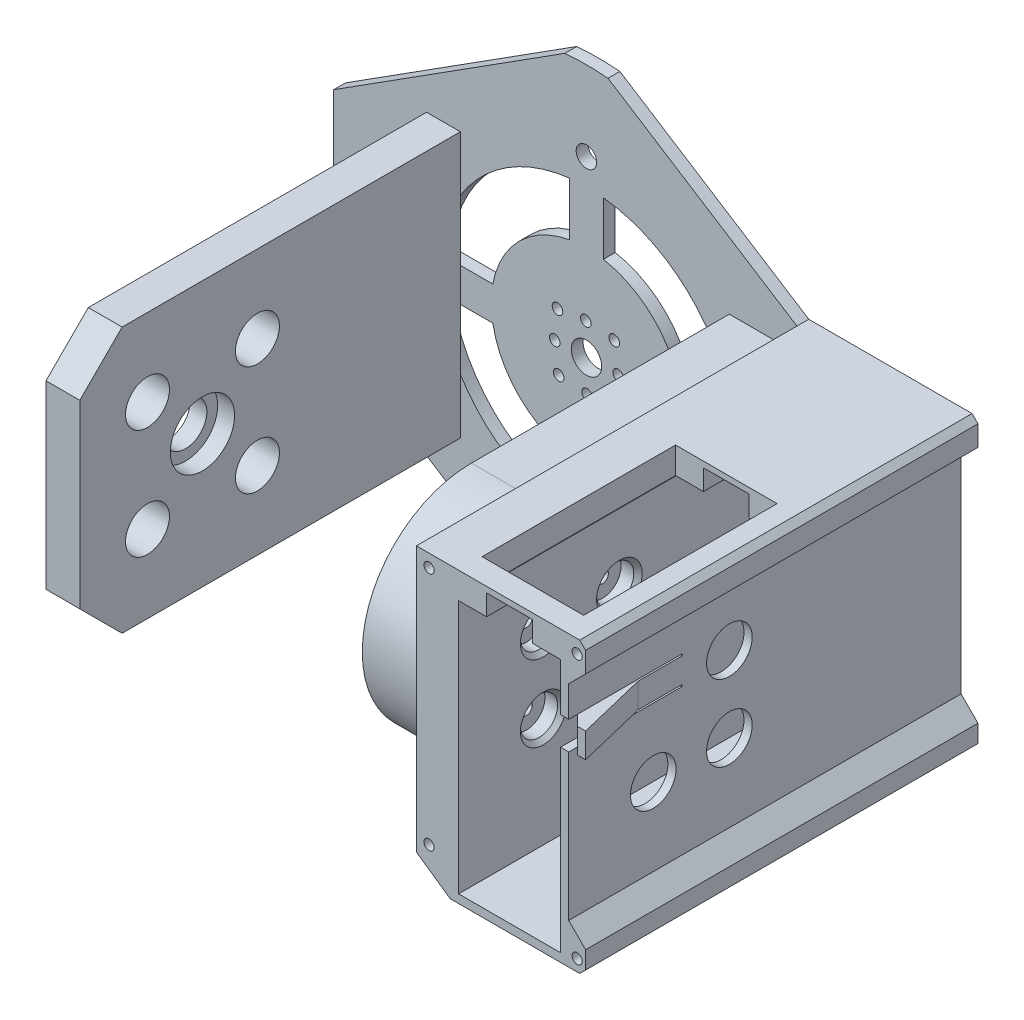
from build123d import *

# Parameters (mm, degrees)
SKETCH_1_R           = 47
SKETCH_1_R_2         = 1.25
SKETCH_1_R_3         = 3.6
SKETCH_1_R_4         = 2.425
EXTRUDE_1_DEPTH      = 3
EXTRUDE_START        = -2.8
SKETCH_2_R           = 2.425
SKETCH_2_R_2         = 47
EXTRUDE_3_DEPTH      = 2.8
SKETCH_3_R           = 2.425
EXTRUDE_4_DEPTH      = 80
CUT_EXTRUDE_1_DEPTH  = 10
EXTRUDE_5_DEPTH      = 16
SKETCH_6_W           = 10
SKETCH_6_H           = 50
EXTRUDE_6_DEPTH      = 10
CUT_EXTRUDE_START    = -16
CUT_EXTRUDE_2_DEPTH  = 16
EXTRUDE_START_2      = -16
EXTRUDE_7_DEPTH      = 16
CUT_EXTRUDE_3_REACH  = 125.588
SKETCH_11_W          = 8
SKETCH_11_H          = 62.723083634
EXTRUDE_8_DEPTH      = 90
SKETCH_12_R          = 5.05
CUT_EXTRUDE_4_DEPTH  = 8
SKETCH_13_W          = 5.4
SKETCH_13_H          = 5.6
SKETCH_13_R          = 1.4
SKETCH_13_W_2        = 1
EXTRUDE_9_DEPTH      = 9
CHAMFER_2_SIZE       = 10
CUT_EXTRUDE_START_2  = -4
SKETCH_14_R          = 4.4
SKETCH_14_R_2        = 1.4
CUT_EXTRUDE_5_DEPTH  = 4
SKETCH_15_R          = 2.425
CUT_EXTRUDE_6_DEPTH  = 2.8
CHAMFER_3_SIZE       = 1
EXTRUDE_10_DEPTH     = 10
SKETCH_17_R          = 47
SKETCH_17_R_2        = 1.25
SKETCH_17_R_3        = 2.425
SKETCH_17_R_4        = 3.6
CUT_EXTRUDE_7_DEPTH  = 0.2
EXTRUDE_START_3      = 82.8
SKETCH_19_R          = 2.425
EXTRUDE_11_DEPTH     = 82.8
SKETCH_20_R          = 2.425
EXTRUDE_12_DEPTH     = 2.8
EXTRUDE_13_DEPTH     = 92.8
SKETCH_22_W          = 92.8
SKETCH_22_H          = 6.241541817
EXTRUDE_14_DEPTH     = 2
EXTRUDE_15_REACH     = 141.907
EXTRUDE_16_DEPTH     = 92.8
SKETCH_25_W          = 92.8
SKETCH_25_H          = 60.05
EXTRUDE_17_DEPTH     = 1.94
CUT_EXTRUDE_8_REACH  = 158.07
SKETCH_26_W          = 24.02
SKETCH_26_H          = 45.757104247
SKETCH_27_W          = 4.81
SKETCH_27_H          = 5.88
EXTRUDE_19_DEPTH     = 3
CUT_EXTRUDE_9_DEPTH  = 1.94
CHAMFER_4_SIZE       = 1
SKETCH_29_W          = 1.94
SKETCH_29_H          = 0.4
CUT_EXTRUDE_10_DEPTH = 10
SKETCH_31_W          = 4
SKETCH_31_H          = 6.241541817
SKETCH_31_R          = 1.2
SKETCH_31_H_2        = 5.568458183
EXTRUDE_21_DEPTH     = 10
SKETCH_32_W          = 4
SKETCH_32_H          = 5.568458183
SKETCH_32_H_2        = 6.241541817
EXTRUDE_22_DEPTH     = 82.8
CHAMFER_5_SIZE       = 4
CHAMFER_6_SIZE       = 1.4
CUT_EXTRUDE_11_DEPTH = 10
EXTRUDE_23_DEPTH     = 5.88
CHAMFER_7_SIZE       = 4
SKETCH_35_R          = 7.6
SKETCH_35_R_2        = 7.5
SKETCH_35_R_3        = 5.05
CUT_EXTRUDE_12_DEPTH = 4
SKETCH_36_R          = 5.2
CUT_EXTRUDE_13_DEPTH = 8
SKETCH_37_R          = 5.4
CUT_EXTRUDE_14_DEPTH = 1.94


with BuildPart() as part:
    # 草图1 → 凸台-拉伸1 (new body)
    with BuildSketch(Plane.XY):
        Circle(SKETCH_1_R)
        with BuildLine():
            Line((34.770677301, 4), (22.141589825, 4))
            ThreePointArc((22.141589825, 4), (15.909902577, 15.909902577), (4, 22.141589825))
            Line((4, 22.141589825), (4, 34.770677301))
            ThreePointArc((4, 34.770677301), (24.748737342, 24.748737342), (34.770677301, 4))
        make_face(mode=Mode.SUBTRACT)
        with BuildLine():
            Line((-4, 34.770677301), (-4, 22.141589825))
            ThreePointArc((-4, 22.141589825), (-15.909902577, 15.909902577), (-22.141589825, 4))
            Line((-22.141589825, 4), (-34.770677301, 4))
            ThreePointArc((-34.770677301, 4), (-24.748737342, 24.748737342), (-4, 34.770677301))
        make_face(mode=Mode.SUBTRACT)
        with BuildLine():
            Line((-34.770677301, -4), (-22.141589825, -4))
            ThreePointArc((-22.141589825, -4), (-15.909902577, -15.909902577), (-4, -22.141589825))
            Line((-4, -22.141589825), (-4, -34.770677301))
            ThreePointArc((-4, -34.770677301), (-24.748737342, -24.748737342), (-34.770677301, -4))
        make_face(mode=Mode.SUBTRACT)
        with BuildLine():
            Line((4, -34.770677301), (4, -22.141589825))
            ThreePointArc((4, -22.141589825), (15.909902577, -15.909902577), (22.141589825, -4))
            Line((22.141589825, -4), (34.770677301, -4))
            ThreePointArc((34.770677301, -4), (24.748737342, -24.748737342), (4, -34.770677301))
        make_face(mode=Mode.SUBTRACT)
        with Locations((-7.498535673, -0.148198363)):
            Circle(SKETCH_1_R_2, mode=Mode.SUBTRACT)
        Circle(SKETCH_1_R_3, mode=Mode.SUBTRACT)
        with Locations((0.148198363, -7.498535673)):
            Circle(SKETCH_1_R_2, mode=Mode.SUBTRACT)
        with Locations((-0.148198363, 7.498535673)):
            Circle(SKETCH_1_R_2, mode=Mode.SUBTRACT)
        with Locations((7.498535673, 0.148198363)):
            Circle(SKETCH_1_R_2, mode=Mode.SUBTRACT)
        with Locations((6.583466251, 6.848939489)):
            Circle(SKETCH_1_R_2, mode=Mode.SUBTRACT)
        with Locations((6.848939489, -6.583466251)):
            Circle(SKETCH_1_R_2, mode=Mode.SUBTRACT)
        with Locations((-6.848939489, 6.583466251)):
            Circle(SKETCH_1_R_2, mode=Mode.SUBTRACT)
        with Locations((-6.583466251, -6.848939489)):
            Circle(SKETCH_1_R_2, mode=Mode.SUBTRACT)
        with Locations((0, -41.175)):
            Circle(SKETCH_1_R_4, mode=Mode.SUBTRACT)
        with Locations((-41.175, 0)):
            Circle(SKETCH_1_R_4, mode=Mode.SUBTRACT)
        with Locations((41.175, 0)):
            Circle(SKETCH_1_R_4, mode=Mode.SUBTRACT)
        with Locations((0, 41.175)):
            Circle(SKETCH_1_R_4, mode=Mode.SUBTRACT)
    extrude(amount=EXTRUDE_1_DEPTH)

    # 草图2 → 凸台-拉伸3 (add)
    # profile 1 of 5: a face of its own
    with BuildSketch(Plane.XY.offset(3).offset(EXTRUDE_START)):
        with BuildLine():
            Line((59.782310964, 25), (51.984099161, 29.960865048))
            ThreePointArc((51.984099161, 29.960865048), (57.248307808, 17.961939013), (59.782310964, 5.106397535))
            Line((59.782310964, 5.106397535), (59.782310964, 25))
        make_face()
    # profile 2 of 5: a face of its own
    with BuildSketch(Plane.XY.offset(3).offset(EXTRUDE_START)):
        with BuildLine():
            Line((59.782310964, -25), (59.782310964, -5.106397535))
            ThreePointArc((59.782310964, -5.106397535), (57.248307808, -17.961939013), (51.984099161, -29.960865048))
            Line((51.984099161, -29.960865048), (59.782310964, -25))
        make_face()
    # profile 3 of 5: a face of its own
    with BuildSketch(Plane.XY.offset(3).offset(EXTRUDE_START)):
        with BuildLine():
            ThreePointArc((5.106397535, 59.782310964), (0, 60), (-5.106397535, 59.782310964))
            Line((-5.106397535, 59.782310964), (-51.984099161, 29.960865048))
            ThreePointArc((-51.984099161, 29.960865048), (-57.248307808, 17.961939013), (-59.782310964, 5.106397535))
            Line((-59.782310964, 5.106397535), (-59.782310964, -5.106397535))
            ThreePointArc((-59.782310964, -5.106397535), (-57.248307808, -17.961939013), (-51.984099161, -29.960865048))
            Line((-51.984099161, -29.960865048), (-5.106397535, -59.782310964))
            ThreePointArc((-5.106397535, -59.782310964), (0, -60), (5.106397535, -59.782310964))
            Line((5.106397535, -59.782310964), (51.984099161, -29.960865048))
            ThreePointArc((51.984099161, -29.960865048), (57.248307808, -17.961939013), (59.782310964, -5.106397535))
            Line((59.782310964, -5.106397535), (59.782310964, 5.106397535))
            ThreePointArc((59.782310964, 5.106397535), (57.248307808, 17.961939013), (51.984099161, 29.960865048))
            Line((51.984099161, 29.960865048), (5.106397535, 59.782310964))
        make_face()
        with Locations((53.575, 0)):
            Circle(SKETCH_2_R, mode=Mode.SUBTRACT)
        with Locations((-53.575, 0)):
            Circle(SKETCH_2_R, mode=Mode.SUBTRACT)
        Circle(SKETCH_2_R_2, mode=Mode.SUBTRACT)
    # profile 4 of 5: a face of its own
    with BuildSketch(Plane.XY.offset(3).offset(EXTRUDE_START)):
        with BuildLine():
            ThreePointArc((-59.782310964, 5.106397535), (-57.248307808, 17.961939013), (-51.984099161, 29.960865048))
            Line((-51.984099161, 29.960865048), (-59.782310964, 25))
            Line((-59.782310964, 25), (-59.782310964, 5.106397535))
        make_face()
    # profile 5 of 5: a face of its own
    with BuildSketch(Plane.XY.offset(3).offset(EXTRUDE_START)):
        with BuildLine():
            ThreePointArc((-51.984099161, -29.960865048), (-57.248307808, -17.961939013), (-59.782310964, -5.106397535))
            Line((-59.782310964, -5.106397535), (-59.782310964, -25))
            Line((-59.782310964, -25), (-51.984099161, -29.960865048))
        make_face()
    extrude(amount=EXTRUDE_3_DEPTH)

    # 草图3 → 凸台-拉伸4 (add)
    # profile 1 of 2: a face of its own
    with BuildSketch(Plane.XY.offset(3)):
        Polygon((59.782310964, 25), (49.782310964, 25), (49.782310964, -31.361541817), (59.782310964, -25), align=None)
        with Locations((53.575, 0)):
            Circle(SKETCH_3_R, mode=Mode.SUBTRACT)
    # profile 2 of 2: a face of its own
    with BuildSketch(Plane.XY.offset(3)):
        Polygon((59.782310964, 25), (49.782310964, 31.361541817), (49.782310964, 25), align=None)
    extrude(amount=EXTRUDE_4_DEPTH)

    # 草图4 → 切除-拉伸1 (cut)
    with BuildSketch(Plane.ZY.offset(-49.782310964)):
        with BuildLine():
            ThreePointArc((71.6, 9), (72.010050506, 8.010050506), (73, 7.6))
            Line((73, 7.6), (73, 9))
            Line((73, 9), (71.6, 9))
        make_face()
        with BuildLine():
            Line((73, 9), (73, 7.6))
            ThreePointArc((73, 7.6), (73.989949494, 8.010050506), (74.4, 9))
            ThreePointArc((74.4, 9), (73, 10.4), (71.6, 9))
            Line((71.6, 9), (73, 9))
        make_face()
        with BuildLine():
            ThreePointArc((56.4, 9), (54.010050506, 9.989949494), (55, 7.6))
            Line((55, 7.6), (55, 9))
            Line((55, 9), (56.4, 9))
        make_face()
        with BuildLine():
            Line((55, 9), (55, 7.6))
            ThreePointArc((55, 7.6), (55.989949494, 8.010050506), (56.4, 9))
            Line((56.4, 9), (55, 9))
        make_face()
        with BuildLine():
            ThreePointArc((56.4, -9), (55.989949494, -8.010050506), (55, -7.6))
            Line((55, -7.6), (55, -9))
            Line((55, -9), (56.4, -9))
        make_face()
        with BuildLine():
            Line((55, -9), (55, -7.6))
            ThreePointArc((55, -7.6), (54.010050506, -9.989949494), (56.4, -9))
            Line((56.4, -9), (55, -9))
        make_face()
        with BuildLine():
            ThreePointArc((74.4, -9), (73.989949494, -8.010050506), (73, -7.6))
            Line((73, -7.6), (73, -9))
            Line((73, -9), (71.6, -9))
            ThreePointArc((71.6, -9), (73, -10.4), (74.4, -9))
        make_face()
        with BuildLine():
            Line((73, -9), (73, -7.6))
            ThreePointArc((73, -7.6), (72.010050506, -8.010050506), (71.6, -9))
            Line((71.6, -9), (73, -9))
        make_face()
    extrude(amount=-CUT_EXTRUDE_1_DEPTH, mode=Mode.SUBTRACT)

    # 草图5 → 凸台-拉伸5 (add)
    with BuildSketch(Plane.ZY.offset(-49.782310964)):
        with BuildLine():
            ThreePointArc((89.8, 0), (88.039966722, 9.365895579), (83, 17.453939383))
            Line((83, 17.453939383), (83, 12.603174203))
            ThreePointArc((83, 12.603174203), (85.829338057, 6.581793069), (86.8, 0))
            ThreePointArc((86.8, 0), (85.829338057, -6.581793069), (83, -12.603174203))
            Line((83, -12.603174203), (83, -17.453939383))
            ThreePointArc((83, -17.453939383), (88.039966722, -9.365895579), (89.8, 0))
        make_face()
        with BuildLine():
            Line((83, 12.603174203), (83, 17.453939383))
            ThreePointArc((83, 17.453939383), (38.2, 0), (83, -17.453939383))
            Line((83, -17.453939383), (83, -12.603174203))
            ThreePointArc((83, -12.603174203), (41.2, 0), (83, 12.603174203))
        make_face()
    extrude(amount=EXTRUDE_5_DEPTH)

    # 草图6 → 凸台-拉伸6 (add)
    with BuildSketch(Plane(origin=(59.782310964, 0, 0), x_dir=(0, 0, -1), z_dir=(1, 0, 0))):
        with Locations((-88, 0)):
            Rectangle(SKETCH_6_W, SKETCH_6_H)
    extrude(amount=-EXTRUDE_6_DEPTH)

    # 草图7 → 切除-拉伸2 (cut)
    with BuildSketch(Plane.ZY.offset(-33.782310964).offset(CUT_EXTRUDE_START)):
        with BuildLine():
            Line((42.003636664, 6), (38.9073716, 6))
            ThreePointArc((38.9073716, 6), (38.2, 0), (38.9073716, -6))
            Line((38.9073716, -6), (42.003636664, -6))
            ThreePointArc((42.003636664, -6), (41.2, 0), (42.003636664, 6))
        make_face()
    extrude(amount=CUT_EXTRUDE_2_DEPTH, mode=Mode.SUBTRACT)

    # 草图8 → 凸台-拉伸7 (add)
    with BuildSketch(Plane.ZY.offset(-33.782310964).offset(EXTRUDE_START_2)):
        with BuildLine():
            ThreePointArc((38.9073716, 6), (48.018135278, 20.253888516), (64, 25.8))
            Line((64, 25.8), (3, 25.8))
            Line((3, 25.8), (3, 6))
            Line((3, 6), (38.9073716, 6))
        make_face()
        with BuildLine():
            Line((3, -25.8), (64, -25.8))
            ThreePointArc((64, -25.8), (48.018135278, -20.253888516), (38.9073716, -6))
            Line((38.9073716, -6), (3, -6))
            Line((3, -6), (3, -25.8))
        make_face()
    extrude(amount=EXTRUDE_7_DEPTH)

    # 草图9 → 切除-拉伸3 (cut, up to next)
    with BuildSketch(Plane(origin=(0, 0, 3), x_dir=(-1, 0, 0), z_dir=(0, 0, -1)), mode=Mode.PRIVATE) as cut_extrude_3_sk1:
        with BuildLine():
            Line((-33.782310964, -6), (-34.481879299, -6))
            ThreePointArc((-34.481879299, -6), (-34.168455933, -7.5839712), (-33.782310964, -9.151801239))
            Line((-33.782310964, -9.151801239), (-33.782310964, -6))
        make_face()
    cut_extrude_3_tool1 = extrude(cut_extrude_3_sk1.sketch, amount=-CUT_EXTRUDE_3_REACH, mode=Mode.PRIVATE) & part.part
    # 草图9 → 切除-拉伸3 (cut, up to next)
    with BuildSketch(Plane(origin=(0, 0, 3), x_dir=(-1, 0, 0), z_dir=(0, 0, -1)), mode=Mode.PRIVATE) as cut_extrude_3_sk2:
        with BuildLine():
            Line((-33.782310964, 6), (-33.782310964, 9.151801239))
            ThreePointArc((-33.782310964, 9.151801239), (-34.168455933, 7.5839712), (-34.481879299, 6))
            Line((-34.481879299, 6), (-33.782310964, 6))
        make_face()
    cut_extrude_3_tool2 = extrude(cut_extrude_3_sk2.sketch, amount=-CUT_EXTRUDE_3_REACH, mode=Mode.PRIVATE) & part.part
    add(cut_extrude_3_tool1.solids().sort_by_distance((34.024391, -7.086431, 3))[0], mode=Mode.SUBTRACT)
    add(cut_extrude_3_tool2.solids().sort_by_distance((34.024391, 7.086431, 3))[0], mode=Mode.SUBTRACT)

    # 草图11 → 凸台-拉伸8 (add)
    with BuildSketch(Plane.XY.offset(3)):
        with Locations((-33.817689036, 0)):
            Rectangle(SKETCH_11_W, SKETCH_11_H)
    extrude(amount=EXTRUDE_8_DEPTH)

    # 草图12 → 切除-拉伸4 (cut)
    with BuildSketch(Plane.ZY.offset(37.817689036)):
        with Locations(Location((64, 0, 0), (0, 0, 270))):
            Circle(SKETCH_12_R)
    extrude(amount=-CUT_EXTRUDE_4_DEPTH, mode=Mode.SUBTRACT)

    # 草图13 → 凸台-拉伸9 (add)
    # profile 1 of 6: a face of its own
    with BuildSketch(Plane.ZY.offset(37.817689036)):
        with Locations((6.7, 14.838458183)):
            Rectangle(SKETCH_13_W, SKETCH_13_H)
        with Locations(Location((6.7, 14.838458183, 0), (0, 0, 270))):
            Circle(SKETCH_13_R, mode=Mode.SUBTRACT)
    # profile 2 of 6: a face of its own
    with BuildSketch(Plane.ZY.offset(37.817689036)):
        with Locations((3.5, 14.838458183)):
            Rectangle(SKETCH_13_W_2, SKETCH_13_H)
    # profile 3 of 6: a face of its own
    with BuildSketch(Plane.ZY.offset(37.817689036)):
        with Locations((6.7, -15.561541817)):
            Rectangle(SKETCH_13_W, SKETCH_13_H)
        with Locations(Location((6.7, -15.561541817, 0), (0, 0, 270))):
            Circle(SKETCH_13_R, mode=Mode.SUBTRACT)
    # profile 4 of 6: a face of its own
    with BuildSketch(Plane.ZY.offset(37.817689036)):
        with Locations((3.5, -15.561541817)):
            Rectangle(SKETCH_13_W_2, SKETCH_13_H)
    # profile 5 of 6: a face of its own
    with BuildSketch(Plane.ZY.offset(37.817689036)):
        with Locations((37.1, -15.561541817)):
            Rectangle(SKETCH_13_W, SKETCH_13_H)
        with Locations(Location((37.1, -15.561541817, 0), (0, 0, 270))):
            Circle(SKETCH_13_R, mode=Mode.SUBTRACT)
    # profile 6 of 6: a face of its own
    with BuildSketch(Plane.ZY.offset(37.817689036)):
        with Locations((37.1, 14.838458183)):
            Rectangle(SKETCH_13_W, SKETCH_13_H)
        with Locations(Location((37.1, 14.838458183, 0), (0, 0, 270))):
            Circle(SKETCH_13_R, mode=Mode.SUBTRACT)
    extrude(amount=EXTRUDE_9_DEPTH)

    # 倒角2
    chamfer_2_edges = [part.edges().sort_by_distance(p)[0] for p in [
        (-33.817689036, -31.361541817, 93),
        (-33.817689036, 31.361541817, 93),
    ]]
    chamfer(chamfer_2_edges, length=CHAMFER_2_SIZE)

    # 草图14 → 切除-拉伸5 (cut)
    # profile 1 of 4: a face of its own
    with BuildSketch(Plane(origin=(59.782310964, 0, 0), x_dir=(0, 0, -1), z_dir=(1, 0, 0)).offset(CUT_EXTRUDE_START_2)):
        with Locations((-73, 9)):
            Circle(SKETCH_14_R)
        with Locations(Location((-73, 9, 0), (0, 0, 270))):
            Circle(SKETCH_14_R_2, mode=Mode.SUBTRACT)
    # profile 2 of 4: a face of its own
    with BuildSketch(Plane(origin=(59.782310964, 0, 0), x_dir=(0, 0, -1), z_dir=(1, 0, 0)).offset(CUT_EXTRUDE_START_2)):
        with Locations((-73, -9)):
            Circle(SKETCH_14_R)
        with Locations(Location((-73, -9, 0), (0, 0, 270))):
            Circle(SKETCH_14_R_2, mode=Mode.SUBTRACT)
    # profile 3 of 4: a face of its own
    with BuildSketch(Plane(origin=(59.782310964, 0, 0), x_dir=(0, 0, -1), z_dir=(1, 0, 0)).offset(CUT_EXTRUDE_START_2)):
        with Locations((-55, -9)):
            Circle(SKETCH_14_R)
        with Locations(Location((-55, -9, 0), (0, 0, 270))):
            Circle(SKETCH_14_R_2, mode=Mode.SUBTRACT)
    # profile 4 of 4: a face of its own
    with BuildSketch(Plane(origin=(59.782310964, 0, 0), x_dir=(0, 0, -1), z_dir=(1, 0, 0)).offset(CUT_EXTRUDE_START_2)):
        with Locations((-55, 9)):
            Circle(SKETCH_14_R)
        with Locations(Location((-55, 9, 0), (0, 0, 270))):
            Circle(SKETCH_14_R_2, mode=Mode.SUBTRACT)
    extrude(amount=CUT_EXTRUDE_5_DEPTH, mode=Mode.SUBTRACT)

    # 草图15 → 切除-拉伸6 (cut)
    with BuildSketch(Plane.XY.offset(3)):
        with Locations((0.001, 53.576)):
            Circle(SKETCH_15_R)
        with Locations((0.001, -53.576)):
            Circle(SKETCH_15_R)
    extrude(amount=-CUT_EXTRUDE_6_DEPTH, mode=Mode.SUBTRACT)

    # 倒角3
    chamfer_3_edges = [part.edges().sort_by_distance(p)[0] for p in [
        (59.782310964, 9, 59.4),
        (59.782310964, -9, 59.4),
        (59.782310964, -9, 77.4),
        (59.782310964, 9, 77.4),
    ]]
    chamfer(chamfer_3_edges, length=CHAMFER_3_SIZE)

    # 草图16 → 凸台-拉伸10 (add)
    with BuildSketch(Plane.XY.offset(83)):
        Polygon((49.782310964, 25), (59.782310964, 25), (49.782310964, 31.361541817), align=None)
        Polygon((49.782310964, -31.361541817), (59.782310964, -25), (49.782310964, -25), align=None)
    extrude(amount=EXTRUDE_10_DEPTH)

    # 草图17 → 切除-拉伸7 (cut)
    with BuildSketch(Plane(origin=(0, 0, 0), x_dir=(-1, 0, 0), z_dir=(0, 0, -1))):
        Circle(SKETCH_17_R)
        with Locations(Location((7.498535673, -0.148198363, 0), (0, 0, 180))):
            Circle(SKETCH_17_R_2, mode=Mode.SUBTRACT)
        with Locations(Location((-7.498535673, 0.148198363, 0), (0, 0, 180))):
            Circle(SKETCH_17_R_2, mode=Mode.SUBTRACT)
        with Locations(Location((0.148198363, 7.498535673, 0), (0, 0, 180))):
            Circle(SKETCH_17_R_2, mode=Mode.SUBTRACT)
        with Locations(Location((0, -41.175, 0), (0, 0, 180))):
            Circle(SKETCH_17_R_3, mode=Mode.SUBTRACT)
        with Locations(Location((0, 41.175, 0), (0, 0, 180))):
            Circle(SKETCH_17_R_3, mode=Mode.SUBTRACT)
        with Locations(Location((6.583466251, -6.848939489, 0), (0, 0, 180))):
            Circle(SKETCH_17_R_2, mode=Mode.SUBTRACT)
        with Locations(Location((-6.848939489, -6.583466251, 0), (0, 0, 180))):
            Circle(SKETCH_17_R_2, mode=Mode.SUBTRACT)
        with Locations(Location((-41.175, 0, 0), (0, 0, 180))):
            Circle(SKETCH_17_R_3, mode=Mode.SUBTRACT)
        with Locations(Location((41.175, 0, 0), (0, 0, 180))):
            Circle(SKETCH_17_R_3, mode=Mode.SUBTRACT)
        with Locations(Location((6.848939489, 6.583466251, 0), (0, 0, 180))):
            Circle(SKETCH_17_R_2, mode=Mode.SUBTRACT)
        with Locations(Location((-6.583466251, 6.848939489, 0), (0, 0, 180))):
            Circle(SKETCH_17_R_2, mode=Mode.SUBTRACT)
        with Locations(Location((0, 0, 0), (0, 0, 180))):
            Circle(SKETCH_17_R_4, mode=Mode.SUBTRACT)
        with Locations(Location((-0.148198363, -7.498535673, 0), (0, 0, 180))):
            Circle(SKETCH_17_R_2, mode=Mode.SUBTRACT)
        with BuildLine():
            ThreePointArc((-22.141589825, -4), (-15.909902577, -15.909902577), (-4, -22.141589825))
            Line((-4, -22.141589825), (-4, -34.770677301))
            ThreePointArc((-4, -34.770677301), (-24.748737342, -24.748737342), (-34.770677301, -4))
            Line((-34.770677301, -4), (-22.141589825, -4))
        make_face(mode=Mode.SUBTRACT)
        with BuildLine():
            ThreePointArc((4, -22.141589825), (15.909902577, -15.909902577), (22.141589825, -4))
            Line((22.141589825, -4), (34.770677301, -4))
            ThreePointArc((34.770677301, -4), (24.748737342, -24.748737342), (4, -34.770677301))
            Line((4, -34.770677301), (4, -22.141589825))
        make_face(mode=Mode.SUBTRACT)
        with BuildLine():
            Line((-22.141589825, 4), (-34.770677301, 4))
            ThreePointArc((-34.770677301, 4), (-24.748737342, 24.748737342), (-4, 34.770677301))
            Line((-4, 34.770677301), (-4, 22.141589825))
            ThreePointArc((-4, 22.141589825), (-15.909902577, 15.909902577), (-22.141589825, 4))
        make_face(mode=Mode.SUBTRACT)
        with BuildLine():
            Line((34.770677301, 4), (22.141589825, 4))
            ThreePointArc((22.141589825, 4), (15.909902577, 15.909902577), (4, 22.141589825))
            Line((4, 22.141589825), (4, 34.770677301))
            ThreePointArc((4, 34.770677301), (24.748737342, 24.748737342), (34.770677301, 4))
        make_face(mode=Mode.SUBTRACT)
    extrude(amount=-CUT_EXTRUDE_7_DEPTH, mode=Mode.SUBTRACT)

    # 草图19 → 凸台-拉伸11 (add)
    with BuildSketch(Plane(origin=(0, 0, 83), x_dir=(-1, 0, 0), z_dir=(0, 0, -1)).offset(EXTRUDE_START_3)):
        with Locations((-53.575, 0)):
            Circle(SKETCH_19_R)
    extrude(amount=-EXTRUDE_11_DEPTH)

    # 草图20 → 凸台-拉伸12 (add)
    with BuildSketch(Plane(origin=(0, 0, 0.2), x_dir=(-1, 0, 0), z_dir=(0, 0, -1)).offset(EXTRUDE_START)):
        with Locations((53.575, 0)):
            Circle(SKETCH_20_R)
        with Locations((-0.001, 53.576)):
            Circle(SKETCH_20_R)
        with Locations((-0.001, -53.576)):
            Circle(SKETCH_20_R)
    extrude(amount=EXTRUDE_12_DEPTH)

    # 草图21 → 凸台-拉伸13 (add)
    with BuildSketch(Plane.XY.offset(93)):
        Polygon((66.372310964, 25.12), (66.372310964, 30), (77.212310964, 30), (77.212310964, 25.12), (83.802310964, 25.12), (83.802310964, 31.361541817), (49.782310964, 31.361541817), (59.662310964, 25.076338502), (59.662310964, 25.12), align=None)
    extrude(amount=-EXTRUDE_13_DEPTH)

    # 草图22 → 凸台-拉伸14 (add)
    with BuildSketch(Plane(origin=(83.802310964, 0, 0), x_dir=(0, 0, -1), z_dir=(1, 0, 0))):
        with Locations((-46.6, 28.240770909)):
            Rectangle(SKETCH_22_W, SKETCH_22_H)
    extrude(amount=EXTRUDE_14_DEPTH)

    # 凸台-拉伸15: up to this face of the body (flat: up to its plane)
    extrude_15_end = Plane(part.part.faces().sort_by_distance((60.734975473, 26.630023141, 0.2))[0])
    # 草图23 → 凸台-拉伸15 (add, up to the picked face)
    with BuildSketch(Plane.XY.offset(93), mode=Mode.PRIVATE) as extrude_15_sk1:
        Polygon((49.782310964, -31.361541817), (57.782310964, -36.93), (57.782310964, -34.93), (57.782310964, -26.272308363), align=None)
    extrude_15_tool1 = split(extrude(extrude_15_sk1.sketch, amount=-EXTRUDE_15_REACH, mode=Mode.PRIVATE), bisect_by=extrude_15_end, keep=Keep.BOTH, mode=Mode.PRIVATE)
    # 草图23 → 凸台-拉伸15 (add, up to the picked face)
    with BuildSketch(Plane.XY.offset(93), mode=Mode.PRIVATE) as extrude_15_sk2:
        Polygon((57.782310964, -34.93), (57.782310964, -36.93), (85.802310964, -36.93), (85.802310964, -34.93), (83.802310964, -34.93), (59.782310964, -34.93), align=None)
    extrude_15_tool2 = split(extrude(extrude_15_sk2.sketch, amount=-EXTRUDE_15_REACH, mode=Mode.PRIVATE), bisect_by=extrude_15_end, keep=Keep.BOTH, mode=Mode.PRIVATE)
    add(extrude_15_tool1.solids().sort_by(Axis((55.115644, -31.521283, 93), (0, 0, -1)))[0])
    add(extrude_15_tool2.solids().sort_by(Axis((71.792311, -35.93, 93), (0, 0, -1)))[0])

    # 草图24 → 凸台-拉伸16 (add)
    with BuildSketch(Plane.XY.offset(93)):
        Polygon((57.782310964, -34.93), (59.782310964, -34.93), (59.782310964, -25), (57.782310964, -26.272308363), align=None)
    extrude(amount=-EXTRUDE_16_DEPTH)

    # 草图25 → 凸台-拉伸17 (add)
    with BuildSketch(Plane(origin=(85.802310964, 0, 0), x_dir=(0, 0, -1), z_dir=(1, 0, 0))):
        with Locations((-46.6, -4.905)):
            Rectangle(SKETCH_25_W, SKETCH_25_H)
    extrude(amount=-EXTRUDE_17_DEPTH)

    # 切除-拉伸8: up to this face of the body (flat: up to its plane)
    cut_extrude_8_end = Plane(part.part.faces().sort_by_distance((63.017310964, 25.12, 46.6))[0])
    # 草图26 → 切除-拉伸8 (cut, up to the picked face)
    with BuildSketch(Plane(origin=(0, 31.361541817, 0), x_dir=(1, 0, 0), z_dir=(0, 1, 0)), mode=Mode.PRIVATE) as cut_extrude_8_sk1:
        with Locations((71.792310964, -64.588552124)):
            Rectangle(SKETCH_26_W, SKETCH_26_H)
    cut_extrude_8_tool1 = split(extrude(cut_extrude_8_sk1.sketch, amount=-CUT_EXTRUDE_8_REACH, mode=Mode.PRIVATE), bisect_by=cut_extrude_8_end, keep=Keep.BOTH, mode=Mode.PRIVATE)
    add(cut_extrude_8_tool1.solids().sort_by(Axis((71.792311, 31.361542, 64.588552), (0, -1, 0)))[0], mode=Mode.SUBTRACT)

    # 草图27 → 凸台-拉伸19 (add)
    with BuildSketch(Plane(origin=(85.802310964, 0, 0), x_dir=(0, 0, -1), z_dir=(1, 0, 0))):
        with Locations((-79.015, 10.49)):
            Rectangle(SKETCH_27_W, SKETCH_27_H)
    extrude(amount=-EXTRUDE_19_DEPTH)

    # 草图28 → 切除-拉伸9 (cut)
    with BuildSketch(Plane(origin=(85.802310964, 0, 0), x_dir=(0, 0, -1), z_dir=(1, 0, 0))):
        Polygon((-93, 7.15), (-81.42, 7.15), (-76.21, 7.15), (-76.21, 7.55), (-76.61, 7.55), (-81.42, 7.55), (-93, 7.55), align=None)
        Polygon((-76.61, 13.43), (-76.21, 13.43), (-76.21, 13.83), (-81.42, 13.83), (-93, 13.83), (-93, 13.43), (-81.42, 13.43), align=None)
    extrude(amount=-CUT_EXTRUDE_9_DEPTH, mode=Mode.SUBTRACT)

    # 倒角4
    chamfer_4_edges = [part.edges().sort_by_distance(p)[0] for p in [
        (82.802310964, 10.49, 76.61),
    ]]
    chamfer(chamfer_4_edges, length=CHAMFER_4_SIZE)

    # 草图29 → 切除-拉伸10 (cut)
    with BuildSketch(Plane.XY.offset(76.21)):
        with Locations((84.832310964, 13.63)):
            Rectangle(SKETCH_29_W, SKETCH_29_H)
        with Locations((84.832310964, 7.35)):
            Rectangle(SKETCH_29_W, SKETCH_29_H)
    extrude(amount=-CUT_EXTRUDE_10_DEPTH, mode=Mode.SUBTRACT)

    # 草图31 → 凸台-拉伸21 (add)
    # profile 1 of 2: a face of its own
    with BuildSketch(Plane.XY.offset(93)):
        with Locations((87.802310964, 28.240770909)):
            Rectangle(SKETCH_31_W, SKETCH_31_H)
        with Locations((87.802310964, 28.240770908)):
            Circle(SKETCH_31_R, mode=Mode.SUBTRACT)
    # profile 2 of 2: a face of its own
    with BuildSketch(Plane.XY.offset(93)):
        with Locations((87.802310964, -34.145770908)):
            Rectangle(SKETCH_31_W, SKETCH_31_H_2)
        with Locations((87.802310964, -34.145770908)):
            Circle(SKETCH_31_R, mode=Mode.SUBTRACT)
    extrude(amount=-EXTRUDE_21_DEPTH)

    # 草图32 → 凸台-拉伸22 (add)
    with BuildSketch(Plane(origin=(0, 0, 83), x_dir=(-1, 0, 0), z_dir=(0, 0, -1))):
        with Locations((-87.802310964, -34.145770908)):
            Rectangle(SKETCH_32_W, SKETCH_32_H)
        with Locations((-87.802310964, 28.240770909)):
            Rectangle(SKETCH_32_W, SKETCH_32_H_2)
    extrude(amount=EXTRUDE_22_DEPTH)

    # 倒角5
    chamfer_5_edges = [part.edges().sort_by_distance(p)[0] for p in [
        (85.802310964, 25.12, 46.6),
        (85.802310964, -31.361541817, 46.6),
    ]]
    chamfer(chamfer_5_edges, length=CHAMFER_5_SIZE - 0.0001)  # a hair under: the kernel refuses the full size

    # 倒角6
    chamfer_6_edges = [part.edges().sort_by_distance(p)[0] for p in [
        (89.802310964, -36.93, 46.6),
        (89.802310964, 31.361541817, 46.6),
    ]]
    chamfer(chamfer_6_edges, length=CHAMFER_6_SIZE)

    # 草图33 → 切除-拉伸11 (cut)
    with BuildSketch(Plane.XY.offset(93)):
        with BuildLine():
            ThreePointArc((53.982310964, 28.361541817), (53.241531083, 29.470197256), (51.933782827, 29.210069954))
            Line((51.933782827, 29.210069954), (53.630839102, 27.513013679))
            ThreePointArc((53.630839102, 27.513013679), (53.890966403, 27.902321698), (53.982310964, 28.361541817))
        make_face()
        with BuildLine():
            Line((53.630839102, 27.513013679), (51.933782827, 29.210069954))
            ThreePointArc((51.933782827, 29.210069954), (51.933782827, 27.513013679), (53.630839102, 27.513013679))
        make_face()
        with BuildLine():
            ThreePointArc((53.982310964, -28.361541817), (53.890966403, -27.902321698), (53.630839102, -27.513013679))
            Line((53.630839102, -27.513013679), (51.933782827, -29.210069954))
            ThreePointArc((51.933782827, -29.210069954), (53.241531083, -29.470197256), (53.982310964, -28.361541817))
        make_face()
        with BuildLine():
            Line((51.933782827, -29.210069954), (53.630839102, -27.513013679))
            ThreePointArc((53.630839102, -27.513013679), (51.933782827, -27.513013679), (51.933782827, -29.210069954))
        make_face()
    extrude(amount=-CUT_EXTRUDE_11_DEPTH, mode=Mode.SUBTRACT)

    # 草图34 → 凸台-拉伸23 (add)
    with BuildSketch(Plane(origin=(0, 13.43, 0), x_dir=(1, 0, 0), z_dir=(0, 1, 0))):
        Polygon((89.802310964, -93), (85.802310964, -76.61), (85.802310964, -93), align=None)
    extrude(amount=-EXTRUDE_23_DEPTH)

    # 倒角7
    chamfer_7_edges = [part.edges().sort_by_distance(p)[0] for p in [
        (83.862310964, 10.49, 93),
    ]]
    chamfer(chamfer_7_edges, length=CHAMFER_7_SIZE)

    # 草图35 → 切除-拉伸12 (cut)
    # profile 1 of 2: a face of its own
    with BuildSketch(Plane(origin=(-29.817689036, 0, 0), x_dir=(0, 0, -1), z_dir=(1, 0, 0)).offset(CUT_EXTRUDE_START_2)):
        with Locations((-64, 0)):
            Circle(SKETCH_35_R)
        with Locations((-64, 0)):
            Circle(SKETCH_35_R_2, mode=Mode.SUBTRACT)
    # profile 2 of 2: a face of its own
    with BuildSketch(Plane(origin=(-29.817689036, 0, 0), x_dir=(0, 0, -1), z_dir=(1, 0, 0)).offset(CUT_EXTRUDE_START_2)):
        with Locations((-64, 0)):
            Circle(SKETCH_35_R_2)
        with Locations(Location((-64, 0, 0), (0, 0, 270))):
            Circle(SKETCH_35_R_3, mode=Mode.SUBTRACT)
    extrude(amount=CUT_EXTRUDE_12_DEPTH, mode=Mode.SUBTRACT)

    # 草图36 → 切除-拉伸13 (cut)
    with BuildSketch(Plane.ZY.offset(37.817689036)):
        with Locations(Location((77, 13, 0), (0, 0, 270))):
            Circle(SKETCH_36_R)
        with Locations(Location((77, -13, 0), (0, 0, 270))):
            Circle(SKETCH_36_R)
        with Locations(Location((51, -13, 0), (0, 0, 270))):
            Circle(SKETCH_36_R)
        with Locations(Location((51, 13, 0), (0, 0, 270))):
            Circle(SKETCH_36_R)
    extrude(amount=-CUT_EXTRUDE_13_DEPTH, mode=Mode.SUBTRACT)

    # 草图37 → 切除-拉伸14 (cut)
    with BuildSketch(Plane(origin=(85.802310964, 0, 0), x_dir=(0, 0, -1), z_dir=(1, 0, 0))):
        with Locations((-73, -9)):
            Circle(SKETCH_37_R)
        with Locations((-55, -9)):
            Circle(SKETCH_37_R)
        with Locations((-55, 9)):
            Circle(SKETCH_37_R)
    extrude(amount=-CUT_EXTRUDE_14_DEPTH, mode=Mode.SUBTRACT)


solid = part.part
